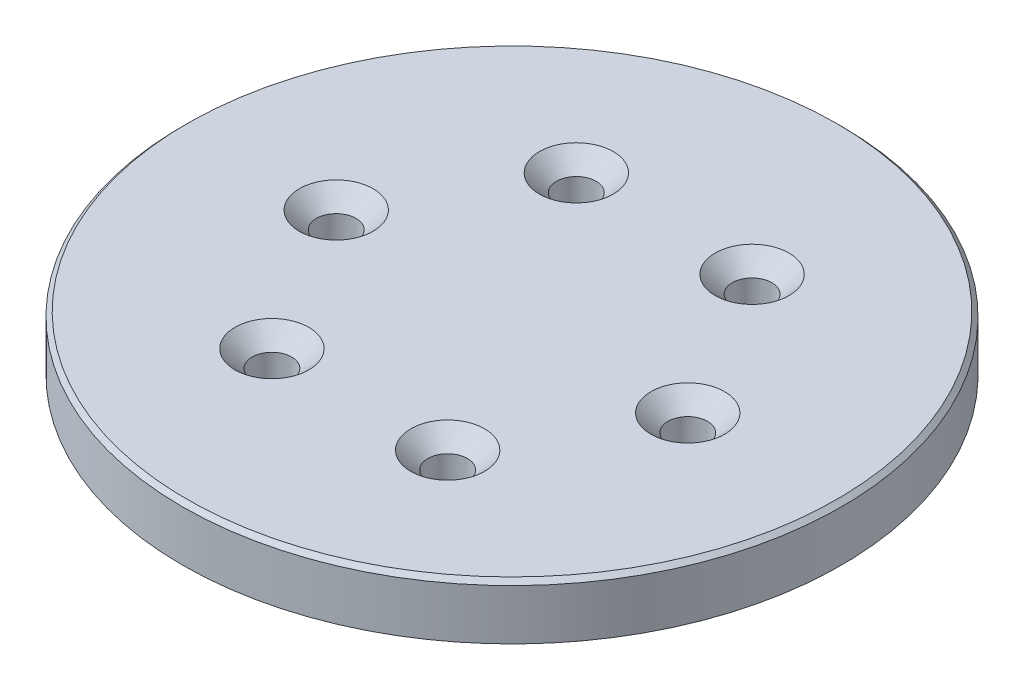
from build123d import *

# Parameters (mm, degrees)
SKETCH1_R           = 30
BOSS_EXTRUDE1_DEPTH = 5
CHAMFER1_SIZE       = 0.4


# Read off the part's stored shape, not the designer's step: CSK for M3 Hex Socket Countersunk Cap Screw1
with BuildPart() as part:
    # Sketch1 → Boss-Extrude1 (new body)
    with BuildSketch(Plane(origin=(0, 0, 0), x_dir=(1, 0, 0), z_dir=(0, 1, 0))):
        with Locations(Location((0, 0, 0), (0, 0, 270))):
            Circle(SKETCH1_R)
    extrude(amount=BOSS_EXTRUDE1_DEPTH)

    # CSK for M3 Hex Socket Countersunk Ca 2 → CSK for M3 Hex Socket Countersunk Cap Screw1 (revolve, cut)
    with BuildSketch(Plane(origin=(8, 0, 13.856406461), x_dir=(1, 0, 0), z_dir=(0, 0, 1))):
        Polygon((0, 0), (1.8, 0), (1.8, 3.44), (3.36, 5), (0, 5), align=None)
    revolve(axis=Axis((8, 0, 13.856406461), (0, 1, 0)), mode=Mode.SUBTRACT)

    # CSK for M3 Hex Socket Countersunk Ca 3 o → CSK for M3 Hex Socket Countersunk Ca 3 (revolve, cut)
    with BuildSketch(Plane(origin=(-8, 0, 13.856406461), x_dir=(1, 0, 0), z_dir=(0, 0, 1))):
        Polygon((0, 0), (1.8, 0), (1.8, 3.44), (3.36, 5), (0, 5), align=None)
    revolve(axis=Axis((-8, 0, 13.856406461), (0, 1, 0)), mode=Mode.SUBTRACT)

    # CSK for M3 Hex Socket Countersunk Ca 4 o → CSK for M3 Hex Socket Countersunk Ca 4 (revolve, cut)
    with BuildSketch(Plane(origin=(-16, 0, 0), x_dir=(1, 0, 0), z_dir=(0, 0, 1))):
        Polygon((0, 0), (1.8, 0), (1.8, 3.44), (3.36, 5), (0, 5), align=None)
    revolve(axis=Axis((-16, 0, 0), (0, 1, 0)), mode=Mode.SUBTRACT)

    # CSK for M3 Hex Socket Countersunk Ca 5 o → CSK for M3 Hex Socket Countersunk Ca 5 (revolve, cut)
    with BuildSketch(Plane(origin=(-8, 0, -13.856406461), x_dir=(1, 0, 0), z_dir=(0, 0, 1))):
        Polygon((0, 0), (1.8, 0), (1.8, 3.44), (3.36, 5), (0, 5), align=None)
    revolve(axis=Axis((-8, 0, -13.856406461), (0, 1, 0)), mode=Mode.SUBTRACT)

    # CSK for M3 Hex Socket Countersunk Ca 6 o → CSK for M3 Hex Socket Countersunk Ca 6 (revolve, cut)
    with BuildSketch(Plane(origin=(8, 0, -13.856406461), x_dir=(1, 0, 0), z_dir=(0, 0, 1))):
        Polygon((0, 0), (1.8, 0), (1.8, 3.44), (3.36, 5), (0, 5), align=None)
    revolve(axis=Axis((8, 0, -13.856406461), (0, 1, 0)), mode=Mode.SUBTRACT)

    # CSK for M3 Hex Socket Countersunk Ca 7 o → CSK for M3 Hex Socket Countersunk Ca 7 (revolve, cut)
    with BuildSketch(Plane(origin=(16, 0, 0), x_dir=(1, 0, 0), z_dir=(0, 0, 1))):
        Polygon((0, 0), (1.8, 0), (1.8, 3.44), (3.36, 5), (0, 5), align=None)
    revolve(axis=Axis((16, 0, 0), (0, 1, 0)), mode=Mode.SUBTRACT)

    # Chamfer1
    chamfer1_edges = [part.edges().sort_by_distance(p)[0] for p in [
        (0, 5, -30),
    ]]
    chamfer(chamfer1_edges, length=CHAMFER1_SIZE)


solid = part.part
